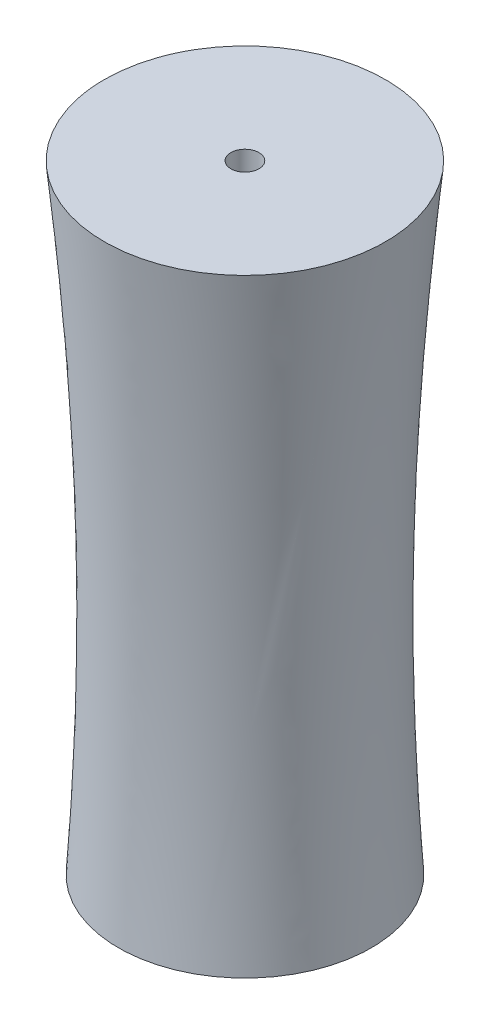
from build123d import *

# Parameters (mm, degrees)
SKETCH4_R          = 0.5
CUT_EXTRUDE1_DEPTH = 24.108440155
SKETCH5_R          = 2.5
CUT_EXTRUDE2_DEPTH = 2


with BuildPart() as part:
    # Loft1: read off the stored shape, not the designer's step
    # Loft1: loft between two sections, ruled curve by curve
    loft1_from = [
        Edge.make_bspline([(4.934796286, 0, 0.8048513), (3.325093686, 0, 10.674443872), (-6.544498886, 0, 9.064741272), (-4.934796286, 0, -0.8048513), (-3.325093686, 0, -10.674443872), (6.544498886, 0, -9.064741272), (4.934796286, 0, 0.8048513)], [0, 0, 0, 0, 0.5, 0.5, 0.5, 1, 1, 1, 1], 3, [1, 0.333333333, 0.333333333, 1, 0.333333333, 0.333333333, 1]),
    ]
    loft1_to = [
        Edge.make_bspline([(2.155997578, -22, 3.949895498), (-5.743793417, -22, 8.261890654), (-10.055788574, -22, 0.362099658), (-2.155997578, -22, -3.949895498), (5.743793417, -22, -8.261890654), (10.055788574, -22, -0.362099658), (2.155997578, -22, 3.949895498)], [0, 0, 0, 0, 0.5, 0.5, 0.5, 1, 1, 1, 1], 3, [1, 0.333333333, 0.333333333, 1, 0.333333333, 0.333333333, 1]),
    ]
    loft1 = Solid(Shell([*[Face.make_surface_from_curves(loft1_from[k], loft1_to[k]) for k in range(1)], Face(Wire(loft1_from)), Face(Wire(loft1_to))]))
    add(loft1)

    # Sketch4 → Cut-Extrude1 (cut, through all)
    with BuildSketch(Plane(origin=(0, 0, 0), x_dir=(1, 0, 0), z_dir=(0, 1, 0))):
        with Locations(Location((0, 0, 0), (0, 0, 270))):
            Circle(SKETCH4_R)
    extrude(amount=-CUT_EXTRUDE1_DEPTH, mode=Mode.SUBTRACT)

    # Sketch5 → Cut-Extrude2 (cut)
    with BuildSketch(Plane.XZ.offset(22)):
        with Locations(Location((0, 0, 0), (0, 0, 270))):
            Circle(SKETCH5_R)
    extrude(amount=-CUT_EXTRUDE2_DEPTH, mode=Mode.SUBTRACT)


solid = part.part
